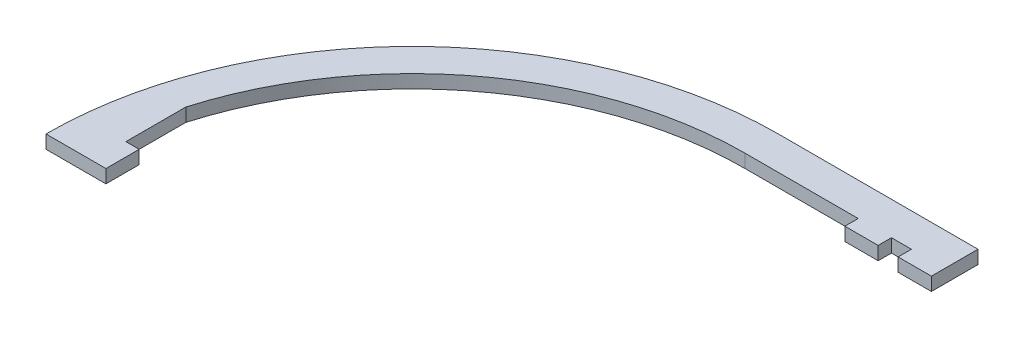
from build123d import *

# Parameters (mm, degrees)
SKETCH1_R              = 50
BOSS_EXTRUDE2_DEPTH    = 2
SPLIT1_SURFACE_1_BACK  = 156.576
SPLIT1_SURFACE_1_DEPTH = 313.152
SPLIT1_SURFACE_2_BACK  = 156.576
SPLIT1_SURFACE_2_DEPTH = 313.152
BODY_DELETE1_DEPTH     = 2
BOSS_EXTRUDE3_DEPTH    = 2
BOSS_EXTRUDE5_START    = -2
SKETCH4_W              = 2
SKETCH4_H              = 5
BOSS_EXTRUDE5_DEPTH    = 2


# Read off the part's stored shape, not the designer's step: Body-Delete1
with BuildPart() as part:
    # Sketch1 → Boss-Extrude2 (new body)
    with BuildSketch(Plane(origin=(0, 0, 0), x_dir=(1, 0, 0), z_dir=(0, 1, 0))):
        with BuildLine():
            Line((22.912878475, 50), (30, 50))
            Line((30, 50), (30, 55))
            Line((30, 55), (0, 55))
            ThreePointArc((0, 55), (-11.7260394, -53.735463151), (22.912878475, 50))
        make_face()
        with Locations(Location((0, 0, 0), (0, 0, 270))):
            Circle(SKETCH1_R, mode=Mode.SUBTRACT)
    extrude(amount=BOSS_EXTRUDE2_DEPTH)


with BuildPart() as body_2:
    # Split1: the piece behind the surface
    add(part.part)
    # Split1 surface: a surface, the sketch's curves swept straight by 313.152 mm
    with BuildLine(Plane(origin=(0, 2, 0), x_dir=(1, 0, 0), z_dir=(0, 1, 0)).offset(-SPLIT1_SURFACE_1_BACK), mode=Mode.PRIVATE) as split1_surface_1_path:
        Line((0, 50), (71.831983425, 50))
        Line((71.831983425, 50), (71.831983425, -59.181674134))
        Line((71.831983425, -59.181674134), (-65.509549092, -59.181674134))
        Line((-65.509549092, -59.181674134), (-65.509549092, 0))
        Line((-65.509549092, 0), (0, 0))
        Line((0, 0), (0, 50))
    split1_surface_1 = Shell.extrude(split1_surface_1_path.wire(), (0 * SPLIT1_SURFACE_1_DEPTH, 1 * SPLIT1_SURFACE_1_DEPTH, 0 * SPLIT1_SURFACE_1_DEPTH))
    split(bisect_by=split1_surface_1, keep=Keep.BOTTOM)

    # Body-Delete1 outline → Body-Delete1 (cut)
    with BuildSketch(Plane(origin=(0, 0, 0), x_dir=(1, 0, 0), z_dir=(0, 1, 0))):
        with BuildLine():
            ThreePointArc((-55, 0), (29.705148408, -46.28827236), (22.912878475, 50))
            Line((22.912878475, 50), (0, 50))
            ThreePointArc((0, 50), (35.355339059, -35.355339059), (-50, 0))
            Line((-50, 0), (-55, 0))
        make_face()
    extrude(amount=BODY_DELETE1_DEPTH, mode=Mode.SUBTRACT)


with BuildPart() as part_1:
    add(part.part)

    # Split1: split by a surface, the side it looks to stays
    # Split1 surface: a surface, the sketch's curves swept straight by 313.152 mm
    with BuildLine(Plane(origin=(0, 2, 0), x_dir=(1, 0, 0), z_dir=(0, 1, 0)).offset(-SPLIT1_SURFACE_2_BACK), mode=Mode.PRIVATE) as split1_surface_2_path:
        Line((0, 50), (71.831983425, 50))
        Line((71.831983425, 50), (71.831983425, -59.181674134))
        Line((71.831983425, -59.181674134), (-65.509549092, -59.181674134))
        Line((-65.509549092, -59.181674134), (-65.509549092, 0))
        Line((-65.509549092, 0), (0, 0))
        Line((0, 0), (0, 50))
    split1_surface_2 = Shell.extrude(split1_surface_2_path.wire(), (0 * SPLIT1_SURFACE_2_DEPTH, 1 * SPLIT1_SURFACE_2_DEPTH, 0 * SPLIT1_SURFACE_2_DEPTH))
    split(bisect_by=split1_surface_2, keep=Keep.TOP)

    # Sketch3 → Boss-Extrude3 (add)
    with BuildSketch(Plane(origin=(0, 2, 0), x_dir=(1, 0, 0), z_dir=(0, 1, 0))):
        Polygon((30, 50), (30, 48), (25, 48), (25, 52), (30, 52), align=None)
        Polygon((22, 50), (22, 48), (17, 48), (17, 52), (22, 52), align=None)
    extrude(amount=-BOSS_EXTRUDE3_DEPTH)

    # Sketch4 → Boss-Extrude5 (add)
    with BuildSketch(Plane(origin=(0, 2, 0), x_dir=(1, 0, 0), z_dir=(0, 1, 0)).offset(BOSS_EXTRUDE5_START)):
        with Locations((-47, 2.5)):
            Rectangle(SKETCH4_W, SKETCH4_H)
        with BuildLine():
            ThreePointArc((-48, 14), (-49.497474683, 7.071067812), (-50, 0))
            Line((-50, 0), (-48, 0))
            Line((-48, 0), (-48, 5))
            Line((-48, 5), (-48, 14))
        make_face()
    extrude(amount=BOSS_EXTRUDE5_DEPTH)


solid = part_1.part
